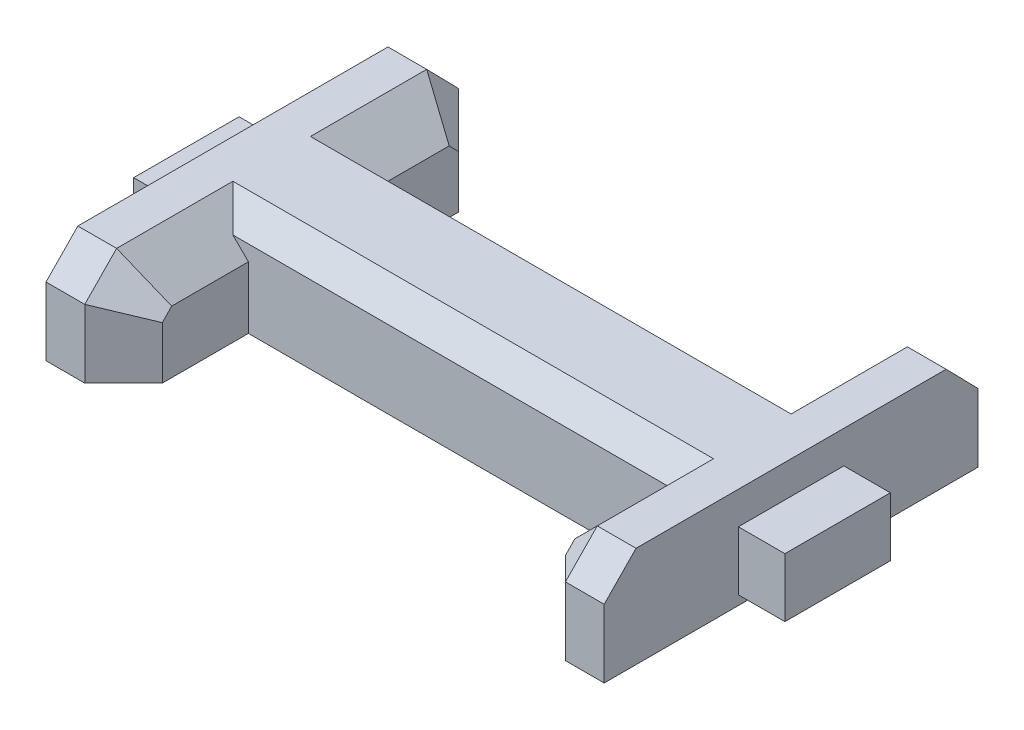
from build123d import *

# Parameters (mm, degrees)
BOSS_EXTRUDE1_DEPTH      = 2.5
BOSS_EXTRUDE1_DEPTH_BACK = 2.5
SKETCH1_W                = 36
SKETCH1_H                = 8
BOSS_EXTRUDE2_DEPTH      = 1.9
BOSS_EXTRUDE2_DEPTH_BACK = 1.9
SKETCH2_W                = 42
SKETCH2_H                = 6.8
BOSS_EXTRUDE4_DEPTH      = 18
BOSS_EXTRUDE4_DEPTH_BACK = 18
BOSS_EXTRUDE5_DEPTH      = 5
CHAMFER1_SIZE            = 2.5


with BuildPart() as part:
    # Sketch1 → Boss-Extrude1 (new, two sides: drawn at the far end of the back side and taken through both)
    with BuildSketch(Plane(origin=(0, 0, 0), x_dir=(1, 0, 0), z_dir=(0, 1, 0)).offset(-BOSS_EXTRUDE1_DEPTH_BACK)):
        Rectangle(SKETCH1_W, SKETCH1_H)
    extrude(amount=BOSS_EXTRUDE1_DEPTH + BOSS_EXTRUDE1_DEPTH_BACK)

    # Sketch2 → Boss-Extrude2 (add, two sides: drawn at the far end of the back side and taken through both)
    with BuildSketch(Plane(origin=(0, 0, 0), x_dir=(1, 0, 0), z_dir=(0, 1, 0)).offset(-BOSS_EXTRUDE2_DEPTH_BACK)):
        Rectangle(SKETCH2_W, SKETCH2_H)
    extrude(amount=BOSS_EXTRUDE2_DEPTH + BOSS_EXTRUDE2_DEPTH_BACK)

    # Sketch3 → Boss-Extrude4 (add, two sides: drawn at the far end of the back side and taken through both)
    with BuildSketch(Plane(origin=(0, 0, 0), x_dir=(0, 0, -1), z_dir=(1, 0, 0)).offset(-BOSS_EXTRUDE4_DEPTH_BACK)):
        Polygon((-4, 2.5), (-2.5, 4), (2.5, 4), (4, 2.5), align=None)
    extrude(amount=BOSS_EXTRUDE4_DEPTH + BOSS_EXTRUDE4_DEPTH_BACK)

    # Sketch4 → Boss-Extrude5 (add)
    with BuildSketch(Plane(origin=(18, 0, 0), x_dir=(0, 0, -1), z_dir=(1, 0, 0))):
        Polygon((10, 4), (-10, 4), (-12.054026971, 1.9), (-12.054026971, -2.5), (12.054026971, -2.5), (12.054026971, 1.9), align=None)
    boss_extrude5 = extrude(amount=-BOSS_EXTRUDE5_DEPTH)

    # Mirror1: Boss-Extrude5 across plane
    add(boss_extrude5.mirror(Plane(origin=(0, 0, 0), x_dir=(0, 0, 1), z_dir=(1, 0, 0))))

    # Chamfer1
    # the kernel refuses this chamfer: 2.5 mm, written as the material it takes off along each edge
    with BuildSketch(Plane(origin=(13, -8.92920747, -12.054026971), x_dir=(-0.027495876610586317, 0, 0.9996219169112968), z_dir=(0, 1, 0)), Plane(origin=(13, 8.32920747, 12.054026971), x_dir=(-0.027495876610586317, 0, -0.9996219169112968), z_dir=(0, -1, 0))) as chamfer1_piece_1:
        Polygon((CHAMFER1_SIZE * 0.999621916911, CHAMFER1_SIZE * 0.0274958766106), (-CHAMFER1_SIZE * 0.0274958766106, CHAMFER1_SIZE * 0.999621916911), (0, 0), align=None)
    extrude(amount=17.25841494, mode=Mode.SUBTRACT)
    with BuildSketch(Plane(origin=(13, 4, -16.42920747), x_dir=(-0.027495876610586317, -0.9996219169112968, 0), z_dir=(0, 0, 1))) as chamfer1_piece_2_section:
        Polygon((CHAMFER1_SIZE * 0.999621916911, CHAMFER1_SIZE * 0.0274958766106), (-CHAMFER1_SIZE * 0.0274958766106, CHAMFER1_SIZE * 0.999621916911), (0, 0), align=None)
    chamfer1_piece_2 = extrude(amount=20.35841494, mode=Mode.PRIVATE)
    chamfer1_piece_2 = split(chamfer1_piece_2, bisect_by=Plane(origin=(13.827805958, -0.281636431, -6.781636431), z_dir=(0, 0.7071067811865474, -0.7071067811865478)), keep=Keep.TOP, mode=Mode.PRIVATE)
    chamfer1_piece_2 = split(chamfer1_piece_2, bisect_by=Plane(origin=(13.827805958, 3.181857543, -4), z_dir=(0, 0, -1)), keep=Keep.TOP, mode=Mode.PRIVATE)
    add(chamfer1_piece_2, mode=Mode.SUBTRACT)
    with BuildSketch(Plane(origin=(13, 4, -16.42920747), x_dir=(-0.027495876610586317, -0.9996219169112968, 0), z_dir=(0, 0, 1))) as chamfer1_piece_3_section:
        Polygon((CHAMFER1_SIZE * 0.999621916911, CHAMFER1_SIZE * 0.0274958766106), (-CHAMFER1_SIZE * 0.0274958766106, CHAMFER1_SIZE * 0.999621916911), (0, 0), align=None)
    chamfer1_piece_3 = extrude(amount=20.35841494, mode=Mode.PRIVATE)
    chamfer1_piece_3 = split(chamfer1_piece_3, bisect_by=Plane(origin=(14.055981956, 3.329802403, -3.170197597), z_dir=(0, 0.7071067811865474, -0.7071067811865478)), keep=Keep.TOP, mode=Mode.PRIVATE)
    chamfer1_piece_3 = split(chamfer1_piece_3, bisect_by=Plane(origin=(14.055981956, 3.606403204, -4), z_dir=(0, 0, 1)), keep=Keep.TOP, mode=Mode.PRIVATE)
    add(chamfer1_piece_3, mode=Mode.SUBTRACT)
    with BuildSketch(Plane(origin=(13, 4, -16.42920747), x_dir=(-0.027495876610586317, -0.9996219169112968, 0), z_dir=(0, 0, 1))) as chamfer1_piece_4_section:
        Polygon((CHAMFER1_SIZE * 0.999621916911, CHAMFER1_SIZE * 0.0274958766106), (-CHAMFER1_SIZE * 0.0274958766106, CHAMFER1_SIZE * 0.999621916911), (0, 0), align=None)
    chamfer1_piece_4 = extrude(amount=20.35841494, mode=Mode.PRIVATE)
    chamfer1_piece_4 = split(chamfer1_piece_4, bisect_by=Plane(origin=(13.178553406, 2.081808313, -4.418191687), z_dir=(0, -0.7071067811865474, 0.7071067811865478)), keep=Keep.TOP, mode=Mode.PRIVATE)
    chamfer1_piece_4 = split(chamfer1_piece_4, bisect_by=Plane(origin=(13.178553406, 1.942411084, -4), z_dir=(0, 0, -1)), keep=Keep.TOP, mode=Mode.PRIVATE)
    add(chamfer1_piece_4, mode=Mode.SUBTRACT)
    with BuildSketch(Plane(origin=(13, 4, -16.42920747), x_dir=(-0.027495876610586317, -0.9996219169112968, 0), z_dir=(0, 0, 1))) as chamfer1_piece_5_section:
        Polygon((CHAMFER1_SIZE * 0.999621916911, CHAMFER1_SIZE * 0.0274958766106), (-CHAMFER1_SIZE * 0.0274958766106, CHAMFER1_SIZE * 0.999621916911), (0, 0), align=None)
    chamfer1_piece_5 = extrude(amount=20.35841494, mode=Mode.PRIVATE)
    chamfer1_piece_5 = split(chamfer1_piece_5, bisect_by=Plane(origin=(14.06552613, 3.360440838, 3.139559162), z_dir=(0, 0.7071067811865476, 0.7071067811865476)), keep=Keep.TOP, mode=Mode.PRIVATE)
    add(chamfer1_piece_5, mode=Mode.SUBTRACT)
    with BuildSketch(Plane(origin=(13, 4, -3.92920747), x_dir=(-0.027495876610586317, -0.9996219169112968, 0), z_dir=(0, 0, 1))) as chamfer1_piece_6_section:
        Polygon((CHAMFER1_SIZE * 0.999621916911, CHAMFER1_SIZE * 0.0274958766106), (-CHAMFER1_SIZE * 0.0274958766106, CHAMFER1_SIZE * 0.999621916911), (0, 0), align=None)
    chamfer1_piece_6 = extrude(amount=20.35841494, mode=Mode.PRIVATE)
    chamfer1_piece_6 = split(chamfer1_piece_6, bisect_by=Plane(origin=(14.06552613, 3.360440838, -3.139559162), z_dir=(0, 0.7071067811865474, -0.7071067811865478)), keep=Keep.TOP, mode=Mode.PRIVATE)
    add(chamfer1_piece_6, mode=Mode.SUBTRACT)
    with BuildSketch(Plane(origin=(13, 4, -3.92920747), x_dir=(-0.027495876610586317, -0.9996219169112968, 0), z_dir=(0, 0, 1))) as chamfer1_piece_7_section:
        Polygon((CHAMFER1_SIZE * 0.999621916911, CHAMFER1_SIZE * 0.0274958766106), (-CHAMFER1_SIZE * 0.0274958766106, CHAMFER1_SIZE * 0.999621916911), (0, 0), align=None)
    chamfer1_piece_7 = extrude(amount=20.35841494, mode=Mode.PRIVATE)
    chamfer1_piece_7 = split(chamfer1_piece_7, bisect_by=Plane(origin=(14.055981956, 3.329802403, 3.170197597), z_dir=(0, 0.7071067811865476, 0.7071067811865476)), keep=Keep.TOP, mode=Mode.PRIVATE)
    chamfer1_piece_7 = split(chamfer1_piece_7, bisect_by=Plane(origin=(14.055981956, 3.606403204, 4), z_dir=(0, 0, -1)), keep=Keep.TOP, mode=Mode.PRIVATE)
    add(chamfer1_piece_7, mode=Mode.SUBTRACT)
    with BuildSketch(Plane(origin=(13, 4, -3.92920747), x_dir=(-0.027495876610586317, -0.9996219169112968, 0), z_dir=(0, 0, 1))) as chamfer1_piece_8_section:
        Polygon((CHAMFER1_SIZE * 0.999621916911, CHAMFER1_SIZE * 0.0274958766106), (-CHAMFER1_SIZE * 0.0274958766106, CHAMFER1_SIZE * 0.999621916911), (0, 0), align=None)
    chamfer1_piece_8 = extrude(amount=20.35841494, mode=Mode.PRIVATE)
    chamfer1_piece_8 = split(chamfer1_piece_8, bisect_by=Plane(origin=(13.178553406, 2.081808313, 4.418191687), z_dir=(0, -0.7071067811865476, -0.7071067811865476)), keep=Keep.TOP, mode=Mode.PRIVATE)
    chamfer1_piece_8 = split(chamfer1_piece_8, bisect_by=Plane(origin=(13.178553406, 1.942411084, 4), z_dir=(0, 0, 1)), keep=Keep.TOP, mode=Mode.PRIVATE)
    add(chamfer1_piece_8, mode=Mode.SUBTRACT)
    with BuildSketch(Plane(origin=(13, 4, -3.92920747), x_dir=(-0.027495876610586317, -0.9996219169112968, 0), z_dir=(0, 0, 1))) as chamfer1_piece_9_section:
        Polygon((CHAMFER1_SIZE * 0.999621916911, CHAMFER1_SIZE * 0.0274958766106), (-CHAMFER1_SIZE * 0.0274958766106, CHAMFER1_SIZE * 0.999621916911), (0, 0), align=None)
    chamfer1_piece_9 = extrude(amount=20.35841494, mode=Mode.PRIVATE)
    chamfer1_piece_9 = split(chamfer1_piece_9, bisect_by=Plane(origin=(13.827805958, -0.281636431, 6.781636431), z_dir=(0, 0.7071067811865476, 0.7071067811865476)), keep=Keep.TOP, mode=Mode.PRIVATE)
    chamfer1_piece_9 = split(chamfer1_piece_9, bisect_by=Plane(origin=(13.827805958, 3.181857543, 4), z_dir=(0, 0, 1)), keep=Keep.TOP, mode=Mode.PRIVATE)
    add(chamfer1_piece_9, mode=Mode.SUBTRACT)
    with BuildSketch(Plane(origin=(-13, -8.92920747, -12.054026971), x_dir=(0.027495876610586317, 0, 0.9996219169112968), z_dir=(0, 1, 0)), Plane(origin=(-13, 8.32920747, 12.054026971), x_dir=(0.027495876610586317, 0, -0.9996219169112968), z_dir=(0, -1, 0))) as chamfer1_piece_10:
        Polygon((CHAMFER1_SIZE * 0.999621916911, -CHAMFER1_SIZE * 0.0274958766106), (-CHAMFER1_SIZE * 0.0274958766106, -CHAMFER1_SIZE * 0.999621916911), (0, 0), align=None)
    extrude(amount=17.25841494, mode=Mode.SUBTRACT)
    with BuildSketch(Plane(origin=(-13, 4, -16.42920747), x_dir=(0.027495876610586317, -0.9996219169112968, 0), z_dir=(0, 0, 1))) as chamfer1_piece_11_section:
        Polygon((CHAMFER1_SIZE * 0.999621916911, -CHAMFER1_SIZE * 0.0274958766106), (-CHAMFER1_SIZE * 0.0274958766106, -CHAMFER1_SIZE * 0.999621916911), (0, 0), align=None)
    chamfer1_piece_11 = extrude(amount=20.35841494, mode=Mode.PRIVATE)
    chamfer1_piece_11 = split(chamfer1_piece_11, bisect_by=Plane(origin=(-13.827805958, 3.181857543, -4), z_dir=(0, 0, -1)), keep=Keep.TOP, mode=Mode.PRIVATE)
    chamfer1_piece_11 = split(chamfer1_piece_11, bisect_by=Plane(origin=(-13.827805958, -0.281636431, -6.781636431), z_dir=(0, 0.7071067811865474, -0.7071067811865478)), keep=Keep.TOP, mode=Mode.PRIVATE)
    add(chamfer1_piece_11, mode=Mode.SUBTRACT)
    with BuildSketch(Plane(origin=(-13, 4, -16.42920747), x_dir=(0.027495876610586317, -0.9996219169112968, 0), z_dir=(0, 0, 1))) as chamfer1_piece_12_section:
        Polygon((CHAMFER1_SIZE * 0.999621916911, -CHAMFER1_SIZE * 0.0274958766106), (-CHAMFER1_SIZE * 0.0274958766106, -CHAMFER1_SIZE * 0.999621916911), (0, 0), align=None)
    chamfer1_piece_12 = extrude(amount=20.35841494, mode=Mode.PRIVATE)
    chamfer1_piece_12 = split(chamfer1_piece_12, bisect_by=Plane(origin=(-14.055981956, 3.606403204, -4), z_dir=(0, 0, 1)), keep=Keep.TOP, mode=Mode.PRIVATE)
    chamfer1_piece_12 = split(chamfer1_piece_12, bisect_by=Plane(origin=(-14.055981956, 3.329802403, -3.170197597), z_dir=(0, 0.7071067811865474, -0.7071067811865478)), keep=Keep.TOP, mode=Mode.PRIVATE)
    add(chamfer1_piece_12, mode=Mode.SUBTRACT)
    with BuildSketch(Plane(origin=(-13, 4, -16.42920747), x_dir=(0.027495876610586317, -0.9996219169112968, 0), z_dir=(0, 0, 1))) as chamfer1_piece_13_section:
        Polygon((CHAMFER1_SIZE * 0.999621916911, -CHAMFER1_SIZE * 0.0274958766106), (-CHAMFER1_SIZE * 0.0274958766106, -CHAMFER1_SIZE * 0.999621916911), (0, 0), align=None)
    chamfer1_piece_13 = extrude(amount=20.35841494, mode=Mode.PRIVATE)
    chamfer1_piece_13 = split(chamfer1_piece_13, bisect_by=Plane(origin=(-13.178553406, 1.942411084, -4), z_dir=(0, 0, -1)), keep=Keep.TOP, mode=Mode.PRIVATE)
    chamfer1_piece_13 = split(chamfer1_piece_13, bisect_by=Plane(origin=(-13.178553406, 2.081808313, -4.418191687), z_dir=(0, -0.7071067811865474, 0.7071067811865478)), keep=Keep.TOP, mode=Mode.PRIVATE)
    add(chamfer1_piece_13, mode=Mode.SUBTRACT)
    with BuildSketch(Plane(origin=(-13, 4, -16.42920747), x_dir=(0.027495876610586317, -0.9996219169112968, 0), z_dir=(0, 0, 1))) as chamfer1_piece_14_section:
        Polygon((CHAMFER1_SIZE * 0.999621916911, -CHAMFER1_SIZE * 0.0274958766106), (-CHAMFER1_SIZE * 0.0274958766106, -CHAMFER1_SIZE * 0.999621916911), (0, 0), align=None)
    chamfer1_piece_14 = extrude(amount=20.35841494, mode=Mode.PRIVATE)
    chamfer1_piece_14 = split(chamfer1_piece_14, bisect_by=Plane(origin=(-14.06552613, 3.360440838, 3.139559162), z_dir=(0, 0.7071067811865476, 0.7071067811865476)), keep=Keep.TOP, mode=Mode.PRIVATE)
    add(chamfer1_piece_14, mode=Mode.SUBTRACT)
    with BuildSketch(Plane(origin=(-13, 4, -3.92920747), x_dir=(0.027495876610586317, -0.9996219169112968, 0), z_dir=(0, 0, 1))) as chamfer1_piece_15_section:
        Polygon((CHAMFER1_SIZE * 0.999621916911, -CHAMFER1_SIZE * 0.0274958766106), (-CHAMFER1_SIZE * 0.0274958766106, -CHAMFER1_SIZE * 0.999621916911), (0, 0), align=None)
    chamfer1_piece_15 = extrude(amount=20.35841494, mode=Mode.PRIVATE)
    chamfer1_piece_15 = split(chamfer1_piece_15, bisect_by=Plane(origin=(-14.06552613, 3.360440838, -3.139559162), z_dir=(0, 0.7071067811865474, -0.7071067811865478)), keep=Keep.TOP, mode=Mode.PRIVATE)
    add(chamfer1_piece_15, mode=Mode.SUBTRACT)
    with BuildSketch(Plane(origin=(-13, 4, -3.92920747), x_dir=(0.027495876610586317, -0.9996219169112968, 0), z_dir=(0, 0, 1))) as chamfer1_piece_16_section:
        Polygon((CHAMFER1_SIZE * 0.999621916911, -CHAMFER1_SIZE * 0.0274958766106), (-CHAMFER1_SIZE * 0.0274958766106, -CHAMFER1_SIZE * 0.999621916911), (0, 0), align=None)
    chamfer1_piece_16 = extrude(amount=20.35841494, mode=Mode.PRIVATE)
    chamfer1_piece_16 = split(chamfer1_piece_16, bisect_by=Plane(origin=(-14.055981956, 3.606403204, 4), z_dir=(0, 0, -1)), keep=Keep.TOP, mode=Mode.PRIVATE)
    chamfer1_piece_16 = split(chamfer1_piece_16, bisect_by=Plane(origin=(-14.055981956, 3.329802403, 3.170197597), z_dir=(0, 0.7071067811865476, 0.7071067811865476)), keep=Keep.TOP, mode=Mode.PRIVATE)
    add(chamfer1_piece_16, mode=Mode.SUBTRACT)
    with BuildSketch(Plane(origin=(-13, 4, -3.92920747), x_dir=(0.027495876610586317, -0.9996219169112968, 0), z_dir=(0, 0, 1))) as chamfer1_piece_17_section:
        Polygon((CHAMFER1_SIZE * 0.999621916911, -CHAMFER1_SIZE * 0.0274958766106), (-CHAMFER1_SIZE * 0.0274958766106, -CHAMFER1_SIZE * 0.999621916911), (0, 0), align=None)
    chamfer1_piece_17 = extrude(amount=20.35841494, mode=Mode.PRIVATE)
    chamfer1_piece_17 = split(chamfer1_piece_17, bisect_by=Plane(origin=(-13.178553406, 1.942411084, 4), z_dir=(0, 0, 1)), keep=Keep.TOP, mode=Mode.PRIVATE)
    chamfer1_piece_17 = split(chamfer1_piece_17, bisect_by=Plane(origin=(-13.178553406, 2.081808313, 4.418191687), z_dir=(0, -0.7071067811865476, -0.7071067811865476)), keep=Keep.TOP, mode=Mode.PRIVATE)
    add(chamfer1_piece_17, mode=Mode.SUBTRACT)
    with BuildSketch(Plane(origin=(-13, 4, -3.92920747), x_dir=(0.027495876610586317, -0.9996219169112968, 0), z_dir=(0, 0, 1))) as chamfer1_piece_18_section:
        Polygon((CHAMFER1_SIZE * 0.999621916911, -CHAMFER1_SIZE * 0.0274958766106), (-CHAMFER1_SIZE * 0.0274958766106, -CHAMFER1_SIZE * 0.999621916911), (0, 0), align=None)
    chamfer1_piece_18 = extrude(amount=20.35841494, mode=Mode.PRIVATE)
    chamfer1_piece_18 = split(chamfer1_piece_18, bisect_by=Plane(origin=(-13.827805958, 3.181857543, 4), z_dir=(0, 0, 1)), keep=Keep.TOP, mode=Mode.PRIVATE)
    chamfer1_piece_18 = split(chamfer1_piece_18, bisect_by=Plane(origin=(-13.827805958, -0.281636431, 6.781636431), z_dir=(0, 0.7071067811865476, 0.7071067811865476)), keep=Keep.TOP, mode=Mode.PRIVATE)
    add(chamfer1_piece_18, mode=Mode.SUBTRACT)
    with BuildSketch(Plane(origin=(13, -2.696167278, -16.54957533), x_dir=(-0.027495876610586303, -0.6989739698056905, 0.7146183361092052), z_dir=(0, 0.7148886234080223, 0.6992383399970165)), Plane(origin=(-13, -2.696167278, -16.54957533), x_dir=(-0.9996219169112968, 0.01922617111794918, -0.019656489379538903), z_dir=(0, 0.7148886234080223, 0.6992383399970165))) as chamfer1_piece_19:
        Polygon((CHAMFER1_SIZE * 0.999621916911, CHAMFER1_SIZE * 0.0274958766106), (-CHAMFER1_SIZE * 0.0274958766106, CHAMFER1_SIZE * 0.999621916911), (0, 0), align=None)
    extrude(amount=15.795935459, mode=Mode.SUBTRACT)
    with BuildSketch(Plane(origin=(13, 8.596167278, 5.504451641), x_dir=(0.9996219169112968, 0.01922617111794934, 0.019656489379539066), z_dir=(0, -0.7148886234080223, 0.6992383399970165)), Plane(origin=(-13, 8.596167278, 5.504451641), x_dir=(0.02749587661058631, -0.6989739698056905, -0.7146183361092052), z_dir=(0, -0.7148886234080223, 0.6992383399970165))) as chamfer1_piece_20:
        Polygon((CHAMFER1_SIZE * 0.999621916911, -CHAMFER1_SIZE * 0.0274958766106), (-CHAMFER1_SIZE * 0.0274958766106, -CHAMFER1_SIZE * 0.999621916911), (0, 0), align=None)
    extrude(amount=15.795935459, mode=Mode.SUBTRACT)


solid = part.part
